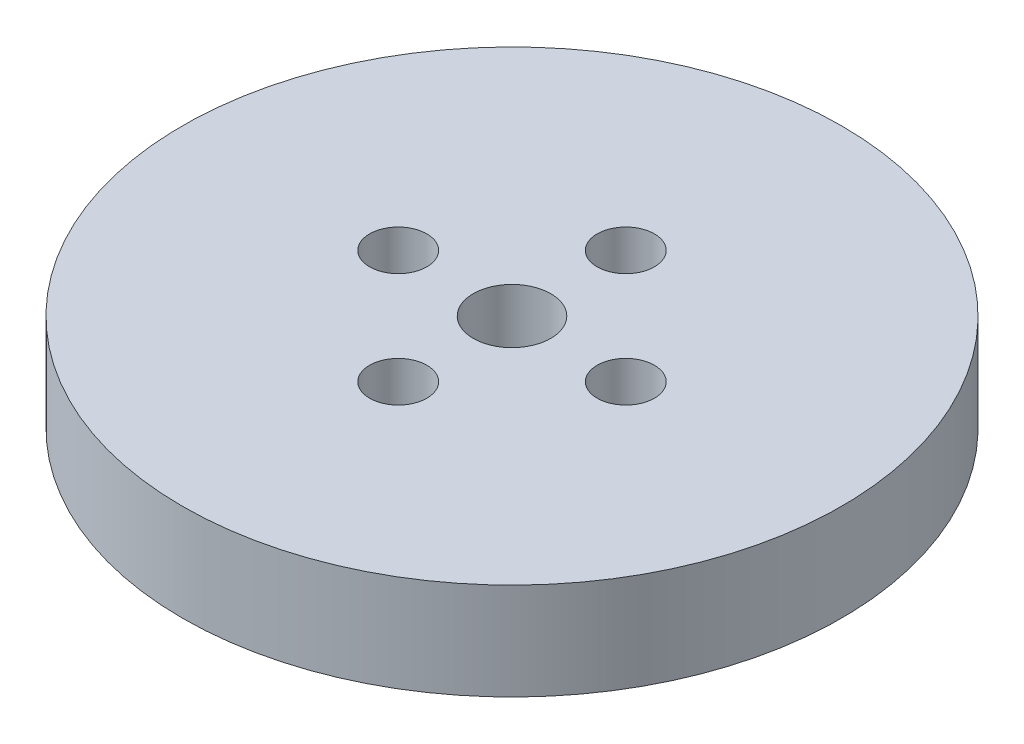
from build123d import *

# Parameters (mm, degrees)
SKETCH1_R           = 85
BOSS_EXTRUDE1_DEPTH = 25
SKETCH2_R           = 10
CUT_EXTRUDE1_DEPTH  = 123.780291578
SKETCH3_R           = 7.380680735
CUT_EXTRUDE2_DEPTH  = 22.620324484
CIRPATTERN1_COUNT   = 4


with BuildPart() as part:
    # Sketch1 → Boss-Extrude1 (new body)
    with BuildSketch(Plane(origin=(0, 0, 0), x_dir=(1, 0, 0), z_dir=(0, 1, 0))):
        Circle(SKETCH1_R)
    extrude(amount=BOSS_EXTRUDE1_DEPTH)

    # Sketch2 → Cut-Extrude1 (cut, through all)
    with BuildSketch(Plane(origin=(0, 0, 0), x_dir=(1, 0, 0), z_dir=(0, 1, 0))):
        Circle(SKETCH2_R)
    extrude(amount=CUT_EXTRUDE1_DEPTH, mode=Mode.SUBTRACT)

    # Sketch3 → Cut-Extrude2 (cut)
    with BuildSketch(Plane(origin=(0, 25, 0), x_dir=(1, 0, 0), z_dir=(0, 1, 0))):
        with Locations((-29.346525836, 0)):
            Circle(SKETCH3_R)
    cut_extrude2 = extrude(amount=-CUT_EXTRUDE2_DEPTH, mode=Mode.SUBTRACT)

    # CirPattern1: Cut-Extrude2 ×4 about axis
    cirpattern1_axis = Axis((0, 0, 0), (0, 1, 0))
    for i in range(1, CIRPATTERN1_COUNT):
        add(cut_extrude2.rotate(cirpattern1_axis, i * 360 / CIRPATTERN1_COUNT), mode=Mode.SUBTRACT)


solid = part.part
